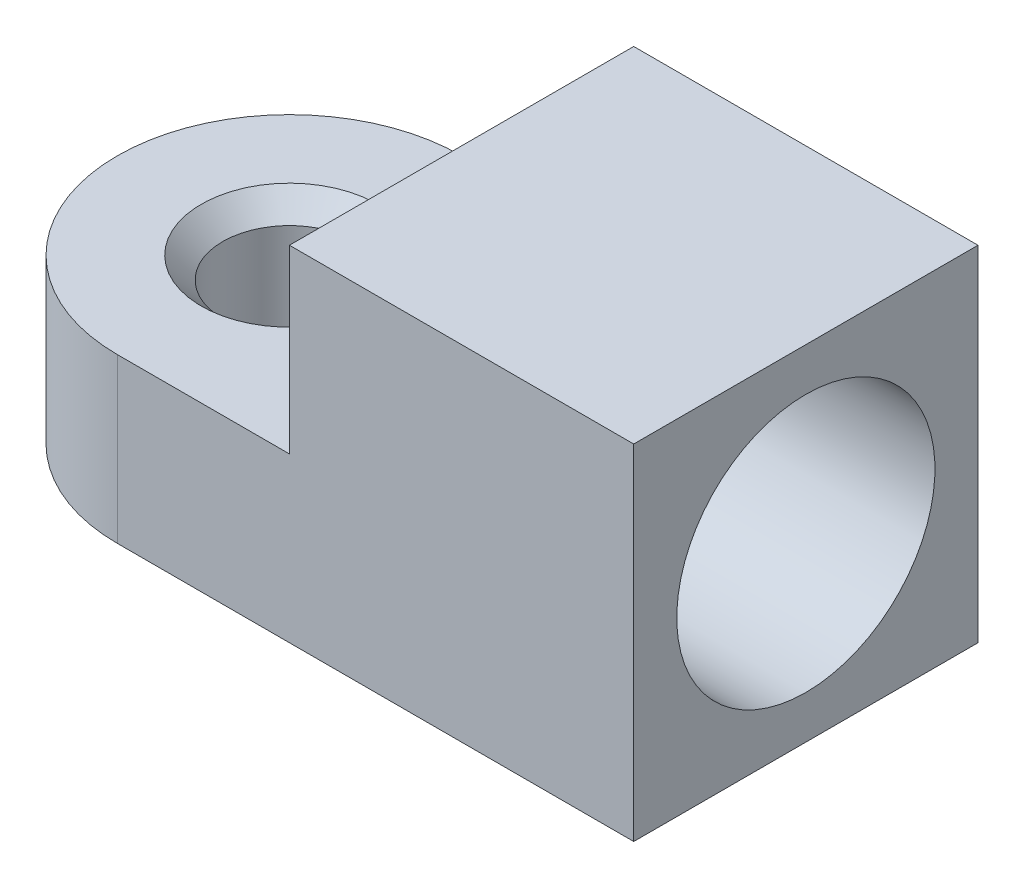
from build123d import *

# Parameters (mm, degrees)
AUFSATZ_LINEAR_AUSTRAGEN1_DEPTH = 4
SKIZZE2_R                       = 3
SCHNITT_LINEAR_AUSTRAGEN1_DEPTH = 7
VERRUNDUNG1_R                   = 4
SKIZZE3_R                       = 1.55
SCHNITT_LINEAR_AUSTRAGEN2_DEPTH = 10.881295462
FASE1_SIZE                      = 0.5


with BuildPart() as part:
    # Skizze1 → Aufsatz-Linear austragen1 (new, symmetric)
    with BuildSketch(Plane.XY):
        Polygon((-8, 0), (8, 0), (8, 8), (0, 8), (0, 3.8), (-8, 3.8), align=None)
    extrude(amount=AUFSATZ_LINEAR_AUSTRAGEN1_DEPTH, both=True)

    # Skizze2 → Schnitt-Linear austragen1 (cut)
    with BuildSketch(Plane(origin=(8, 0, 0), x_dir=(0, 0, -1), z_dir=(1, 0, 0))):
        with Locations(Location((0, 4, 0), (0, 0, 90))):
            Circle(SKIZZE2_R)
    extrude(amount=-SCHNITT_LINEAR_AUSTRAGEN1_DEPTH, mode=Mode.SUBTRACT)

    # Verrundung1
    verrundung1_edges = [part.edges().sort_by_distance(p)[0] for p in [
        (-8, 1.9, -4),
        (-8, 1.9, 4),
    ]]
    fillet(verrundung1_edges, radius=VERRUNDUNG1_R - 0.0001)  # a hair under: the kernel refuses the full size

    # Skizze3 → Schnitt-Linear austragen2 (cut, through all)
    with BuildSketch(Plane(origin=(0, 3.8, 0), x_dir=(1, 0, 0), z_dir=(0, 1, 0))):
        with Locations(Location((-4, 0, 0), (0, 0, 180))):
            Circle(SKIZZE3_R)
    extrude(amount=-SCHNITT_LINEAR_AUSTRAGEN2_DEPTH, mode=Mode.SUBTRACT)

    # Fase1
    fase1_edges = [part.edges().sort_by_distance(p)[0] for p in [
        (-2.45, 3.8, 0),
    ]]
    chamfer(fase1_edges, length=FASE1_SIZE)


solid = part.part
